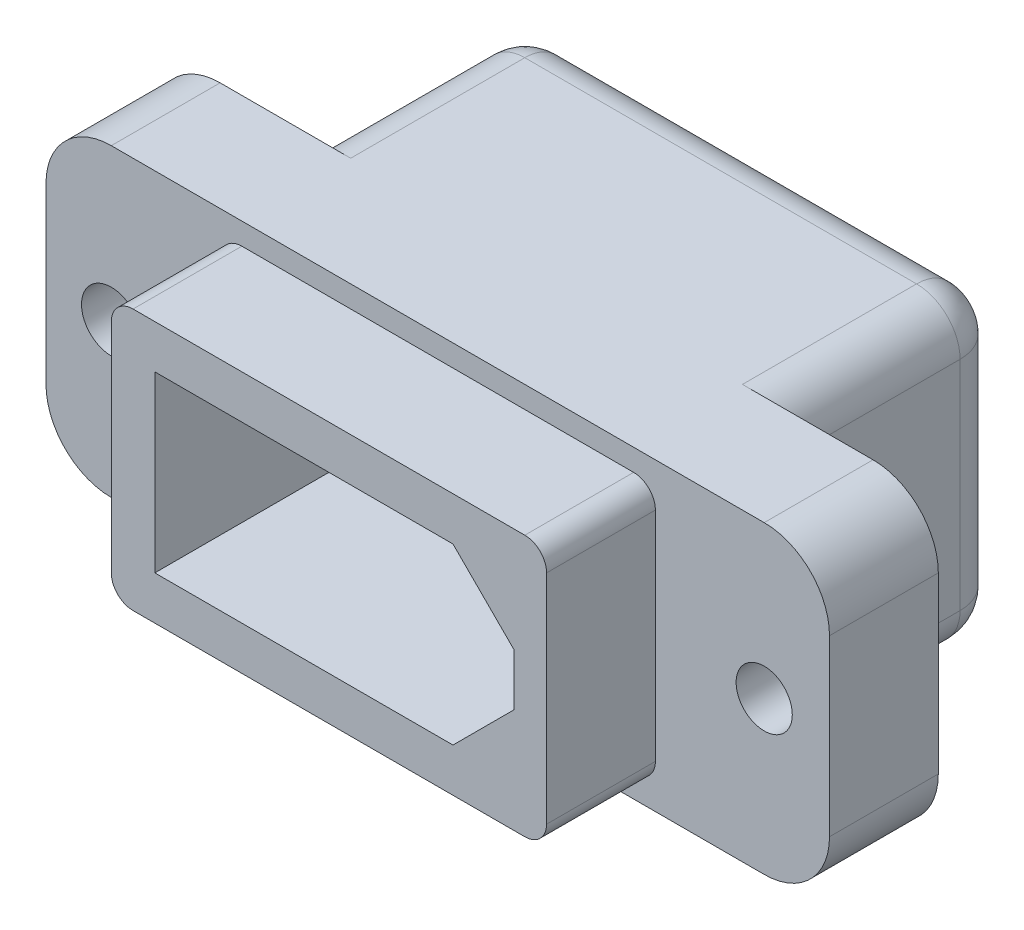
from build123d import *

# Parameters (mm, degrees)
SKETCH_1_W      = 36
SKETCH_1_H      = 14
SKETCH_1_R      = 1.368610336
SKETCH_1_R_2    = 1.290695583
EXTRUDE_1_DEPTH = 5
SKETCH_2_W      = 22
SKETCH_2_H      = 14
EXTRUDE_2_DEPTH = 6
SKETCH_3_W      = 22
SKETCH_3_H      = 14
SKETCH_3_W_2    = 14.5
SKETCH_3_H_2    = 6
EXTRUDE_3_DEPTH = 4
FILLET_1_R      = 3
FILLET_2_R      = 2
FILLET_3_R      = 2
SKETCH_4_W      = 20
SKETCH_4_H      = 12
EXTRUDE_4_DEPTH = 5
FILLET_4_R      = 1


with BuildPart() as part:
    # Эскиз1 → Бобышка-Вытянуть1 (new body)
    with BuildSketch(Plane.XY):
        with Locations((8, -4)):
            Rectangle(SKETCH_1_W, SKETCH_1_H)
        with Locations((-7, -4)):
            Circle(SKETCH_1_R, mode=Mode.SUBTRACT)
        with Locations((23, -4)):
            Circle(SKETCH_1_R_2, mode=Mode.SUBTRACT)
        Polygon((13.7, 0), (16.5, -2.8), (16.5, -5.2), (13.7, -8), (0, -8), (0, 0), align=None, mode=Mode.SUBTRACT)
    extrude(amount=EXTRUDE_1_DEPTH)

    # Эскиз2 → Бобышка-Вытянуть2 (add)
    with BuildSketch(Plane(origin=(0, 0, 0), x_dir=(-1, 0, 0), z_dir=(0, 0, -1))):
        with Locations((-8, -4)):
            Rectangle(SKETCH_2_W, SKETCH_2_H)
        Polygon((-16.5, -2.8), (-13.7, 0), (0, 0), (0, -8), (-13.7, -8), (-16.5, -5.2), align=None, mode=Mode.SUBTRACT)
    extrude(amount=EXTRUDE_2_DEPTH)

    # Эскиз3 → Бобышка-Вытянуть3 (add)
    with BuildSketch(Plane(origin=(0, 0, -6), x_dir=(-1, 0, 0), z_dir=(0, 0, -1))):
        with Locations((-8, -4)):
            Rectangle(SKETCH_3_W, SKETCH_3_H)
        with Locations((-8.25, -4)):
            Rectangle(SKETCH_3_W_2, SKETCH_3_H_2, mode=Mode.SUBTRACT)
    extrude(amount=EXTRUDE_3_DEPTH)

    # Скругление1
    fillet_1_edges = [part.edges().sort_by_distance(p)[0] for p in [
        (-10, 3, 2.5),
        (26, 3, 2.5),
        (26, -11, 2.5),
        (-10, -11, 2.5),
    ]]
    fillet(fillet_1_edges, radius=FILLET_1_R)

    # Скругление2
    # the kernel refuses this fillet: 2 mm, written as the material it adds along each edge
    with BuildSketch(Plane(origin=(15.5, -7, -6), x_dir=(0, 1, 0), z_dir=(0, 0, -1)), Plane(origin=(1, -7, -6), x_dir=(1, 0, 0), z_dir=(0, 0, -1)), Plane(origin=(1, -1, -6), x_dir=(0, -1, 0), z_dir=(0, 0, -1))) as fillet_2_piece_1:
        with BuildLine():
            CenterArc((FILLET_2_R, -FILLET_2_R), FILLET_2_R, 90, 90)
            Line((0, -FILLET_2_R), (0, 0))
            Line((0, 0), (FILLET_2_R, 0))
        make_face()
    extrude(amount=4)
    with BuildSketch(Plane(origin=(15.5, -1, -6), x_dir=(0, -1, 0), z_dir=(0, 0, -1))) as fillet_2_piece_2:
        with BuildLine():
            CenterArc((FILLET_2_R, FILLET_2_R), FILLET_2_R, 180, 90)
            Line((0, FILLET_2_R), (0, 0))
            Line((0, 0), (FILLET_2_R, 0))
        make_face()
    extrude(amount=4)
    # the kernel refuses this fillet: 2 mm, written as the material it takes off along each edge
    with BuildSketch(Plane(origin=(19, 3, 0), x_dir=(-1, 0, 0), z_dir=(0, 0, -1)), Plane(origin=(-3, 3, -15), x_dir=(1, 0, 0), z_dir=(0, 0, 1))) as fillet_2_2_piece_1:
        with BuildLine():
            CenterArc((FILLET_2_R, -FILLET_2_R), FILLET_2_R, 90, 90)
            Line((0, -FILLET_2_R), (0, 0))
            Line((0, 0), (FILLET_2_R, 0))
        make_face()
    extrude(amount=15, mode=Mode.SUBTRACT)
    with BuildSketch(Plane(origin=(19, -11, 0), x_dir=(-1, 0, 0), z_dir=(0, 0, -1)), Plane(origin=(-3, -11, -15), x_dir=(1, 0, 0), z_dir=(0, 0, 1))) as fillet_2_2_piece_2:
        with BuildLine():
            CenterArc((FILLET_2_R, FILLET_2_R), FILLET_2_R, 180, 90)
            Line((0, FILLET_2_R), (0, 0))
            Line((0, 0), (FILLET_2_R, 0))
        make_face()
    extrude(amount=15, mode=Mode.SUBTRACT)

    # Скругление3
    # the kernel refuses this fillet: 2 mm, written as the material it takes off along each edge
    with BuildSketch(Plane(origin=(13.5, -1, -10), x_dir=(0, 1, 0), z_dir=(-1, 0, 0)), Plane(origin=(3, -7, -10), x_dir=(0, -1, 0), z_dir=(1, 0, 0))) as fillet_3_piece_1:
        with BuildLine():
            CenterArc((FILLET_3_R, -FILLET_3_R), FILLET_3_R, 90, 90)
            Line((0, -FILLET_3_R), (0, 0))
            Line((0, 0), (FILLET_3_R, 0))
        make_face()
    extrude(amount=10.5, mode=Mode.SUBTRACT)
    with BuildSketch(Plane(origin=(15.5, -5, -10), x_dir=(1, 0, 0), z_dir=(0, 1, 0)), Plane(origin=(1, -3, -10), x_dir=(-1, 0, 0), z_dir=(0, -1, 0))) as fillet_3_piece_2:
        with BuildLine():
            CenterArc((FILLET_3_R, -FILLET_3_R), FILLET_3_R, 90, 90)
            Line((0, -FILLET_3_R), (0, 0))
            Line((0, 0), (FILLET_3_R, 0))
        make_face()
    extrude(amount=2, mode=Mode.SUBTRACT)
    with BuildSketch(Plane(origin=(-3, 1, -10), x_dir=(1, 0, 0), z_dir=(0, -1, 0)), Plane(origin=(19, -9, -10), x_dir=(-1, 0, 0), z_dir=(0, 1, 0))) as fillet_3_piece_3:
        with BuildLine():
            CenterArc((FILLET_3_R, FILLET_3_R), FILLET_3_R, 180, 90)
            Line((0, FILLET_3_R), (0, 0))
            Line((0, 0), (FILLET_3_R, 0))
        make_face()
    extrude(amount=10, mode=Mode.SUBTRACT)
    with BuildSketch(Plane(origin=(-1, -11, -10), x_dir=(0, 1, 0), z_dir=(1, 0, 0)), Plane(origin=(17, 3, -10), x_dir=(0, -1, 0), z_dir=(-1, 0, 0))) as fillet_3_piece_4:
        with BuildLine():
            CenterArc((FILLET_3_R, FILLET_3_R), FILLET_3_R, 180, 90)
            Line((0, FILLET_3_R), (0, 0))
            Line((0, 0), (FILLET_3_R, 0))
        make_face()
    extrude(amount=18, mode=Mode.SUBTRACT)
    with BuildSketch(Plane(origin=(17, 1, -10), x_dir=(1, 0, 0), z_dir=(0, -1, 0))) as fillet_3_piece_5:
        with BuildLine():
            CenterArc((2 - FILLET_3_R, FILLET_3_R), FILLET_3_R, 270, 90)
            Line((2, FILLET_3_R), (2, 0))
            Line((2, 0), (2 - FILLET_3_R, 0))
        make_face()
    revolve(axis=Axis((17, 1, -10), (0, 0, 1)), revolution_arc=90, mode=Mode.SUBTRACT)
    with BuildSketch(Plane(origin=(17, -9, -10), x_dir=(0, -1, 0), z_dir=(-1, 0, 0))) as fillet_3_piece_6:
        with BuildLine():
            CenterArc((2 - FILLET_3_R, FILLET_3_R), FILLET_3_R, 270, 90)
            Line((2, FILLET_3_R), (2, 0))
            Line((2, 0), (2 - FILLET_3_R, 0))
        make_face()
    revolve(axis=Axis((17, -9, -10), (0, 0, 1)), revolution_arc=90, mode=Mode.SUBTRACT)
    with BuildSketch(Plane(origin=(-1, 1, -10), x_dir=(-1, 0, 0), z_dir=(0, -1, 0))) as fillet_3_piece_7:
        with BuildLine():
            CenterArc((2 - FILLET_3_R, -FILLET_3_R), FILLET_3_R, 0, 90)
            Line((2, -FILLET_3_R), (2, 0))
            Line((2, 0), (2 - FILLET_3_R, 0))
        make_face()
    revolve(axis=Axis((-1, 1, -10), (0, 0, -1)), revolution_arc=90, mode=Mode.SUBTRACT)
    with BuildSketch(Plane(origin=(-1, -9, -10), x_dir=(0, -1, 0), z_dir=(1, 0, 0))) as fillet_3_piece_8:
        with BuildLine():
            CenterArc((2 - FILLET_3_R, -FILLET_3_R), FILLET_3_R, 0, 90)
            Line((2, -FILLET_3_R), (2, 0))
            Line((2, 0), (2 - FILLET_3_R, 0))
        make_face()
    revolve(axis=Axis((-1, -9, -10), (0, 0, -1)), revolution_arc=90, mode=Mode.SUBTRACT)
    with BuildSketch(Plane(origin=(13.5, -3, -10), x_dir=(0, 1, 0), z_dir=(-1, 0, 0))) as fillet_3_piece_9:
        with BuildLine():
            CenterArc((2 + FILLET_3_R, -FILLET_3_R), FILLET_3_R, 90, 90)
            Line((2 + FILLET_3_R, 0), (2, 0))
            Line((2, 0), (2, -FILLET_3_R))
        make_face()
    revolve(axis=Axis((13.5, -3, -10), (0, 0, -1)), revolution_arc=90, mode=Mode.SUBTRACT)
    with BuildSketch(Plane(origin=(13.5, -5, -10), x_dir=(1, 0, 0), z_dir=(0, 1, 0))) as fillet_3_piece_10:
        with BuildLine():
            CenterArc((2 + FILLET_3_R, -FILLET_3_R), FILLET_3_R, 90, 90)
            Line((2, -FILLET_3_R), (2, 0))
            Line((2, 0), (2 + FILLET_3_R, 0))
        make_face()
    revolve(axis=Axis((13.5, -5, -10), (0, 0, -1)), revolution_arc=90, mode=Mode.SUBTRACT)
    with BuildSketch(Plane(origin=(3, -5, -10), x_dir=(0, -1, 0), z_dir=(1, 0, 0))) as fillet_3_piece_11:
        with BuildLine():
            CenterArc((2 + FILLET_3_R, -FILLET_3_R), FILLET_3_R, 90, 90)
            Line((2, -FILLET_3_R), (2, 0))
            Line((2, 0), (2 + FILLET_3_R, 0))
        make_face()
    revolve(axis=Axis((3, -5, -10), (0, 0, -1)), revolution_arc=90, mode=Mode.SUBTRACT)
    with BuildSketch(Plane(origin=(3, -3, -10), x_dir=(-1, 0, 0), z_dir=(0, -1, 0))) as fillet_3_piece_12:
        with BuildLine():
            CenterArc((2 + FILLET_3_R, -FILLET_3_R), FILLET_3_R, 90, 90)
            Line((2, -FILLET_3_R), (2, 0))
            Line((2, 0), (2 + FILLET_3_R, 0))
        make_face()
    revolve(axis=Axis((3, -3, -10), (0, 0, -1)), revolution_arc=90, mode=Mode.SUBTRACT)

    # Эскиз4 → Бобышка-Вытянуть4 (add)
    with BuildSketch(Plane.XY.offset(5)):
        with Locations((8, -4)):
            Rectangle(SKETCH_4_W, SKETCH_4_H)
        Polygon((0, 0), (13.7, 0), (16.5, -2.8), (16.5, -5.2), (13.7, -8), (0, -8), align=None, mode=Mode.SUBTRACT)
    extrude(amount=EXTRUDE_4_DEPTH)

    # Скругление4
    fillet_4_edges = [part.edges().sort_by_distance(p)[0] for p in [
        (-2, 2, 7.5),
        (-2, -10, 7.5),
        (18, -10, 7.5),
        (18, 2, 7.5),
    ]]
    fillet(fillet_4_edges, radius=FILLET_4_R)


solid = part.part
